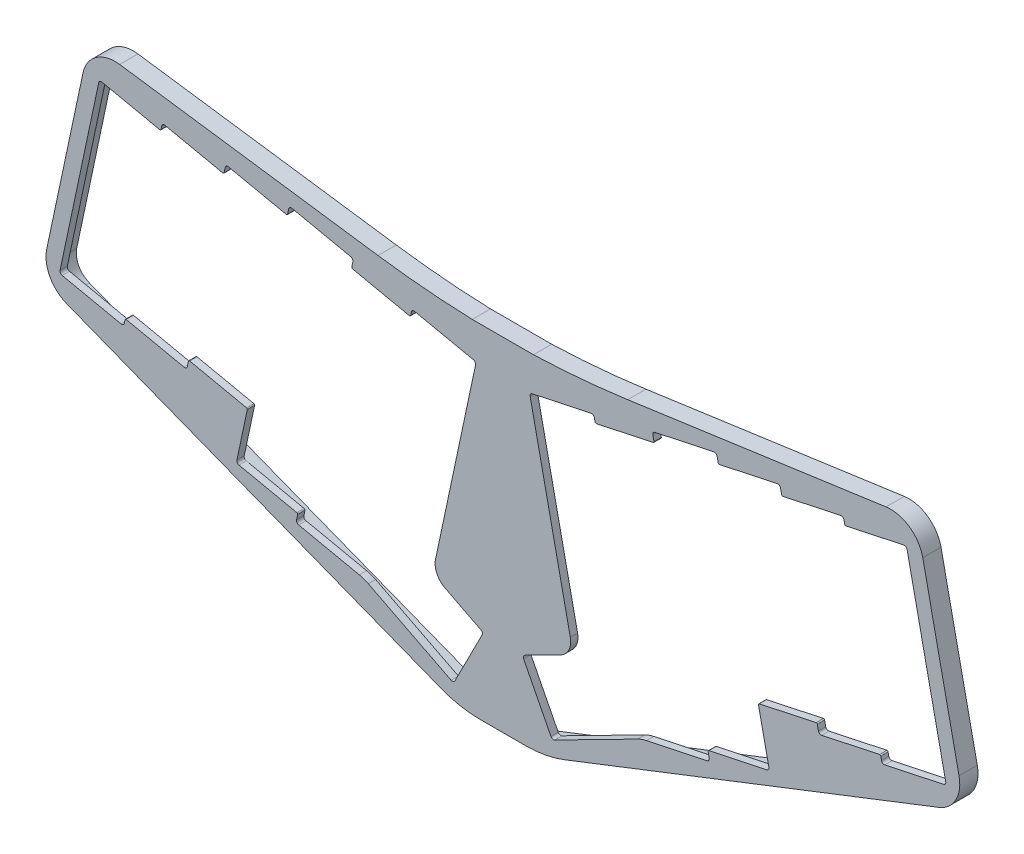
from build123d import *

# Parameters (mm, degrees)
BOSS_EXTRUDE1_DEPTH = 2
BOSS_EXTRUDE2_START = -3
BOSS_EXTRUDE2_DEPTH = 3


with BuildPart() as part:
    # Model → Boss-Extrude1 (new body)
    with BuildSketch(Plane.XY):
        with BuildLine():
            Line((122.868008661, 55.564187288), (106.084164539, 55.564187288))
            ThreePointArc((106.084164539, 55.564187288), (93.132142109, 56.348698919), (80.239503764, 57.815061775))
            Line((80.239503764, 57.815061775), (9.417836232, 67.768398044))
            ThreePointArc((9.417836232, 67.768398044), (3.003090393, 66.228353822), (-0.638050084, 60.727190636))
            Line((-0.638050084, 60.727190636), (-10.587757601, 13.917496875))
            ThreePointArc((-10.587757601, 13.917496875), (-9.704688554, 7.772009077), (-5.052472582, 3.660595964))
            Line((-5.052472582, 3.660595964), (97.645052459, -36.362316839))
            ThreePointArc((97.645052459, -36.362316839), (102.818021289, -37.842589824), (108.175414493, -38.3417418))
            Line((108.175414493, -38.3417418), (120.776758707, -38.3417418))
            ThreePointArc((120.776758707, -38.3417418), (126.134151911, -37.842589824), (131.307120741, -36.362316839))
            Line((131.307120741, -36.362316839), (234.004645782, 3.660595964))
            ThreePointArc((234.004645782, 3.660595964), (238.656861754, 7.772009077), (239.539930801, 13.917496875))
            Line((239.539930801, 13.917496875), (229.590223284, 60.727190636))
            ThreePointArc((229.590223284, 60.727190636), (225.949082807, 66.228353822), (219.534336968, 67.768398044))
            Line((219.534336968, 67.768398044), (148.712669436, 57.815061775))
            ThreePointArc((148.712669436, 57.815061775), (135.820031091, 56.348698919), (122.868008661, 55.564187288))
        make_face()
        with BuildLine():
            ThreePointArc((96.003678434, -6.4654003), (96.381490019, -9.657514237), (98.624463943, -11.959991371))
            Line((98.624463943, -11.959991371), (108.460847672, -16.971879206))
            ThreePointArc((108.460847672, -16.971879206), (108.833647186, -17.408371351), (108.788609694, -17.980626972))
            Line((108.788609694, -17.980626972), (101.297766493, -32.682234674))
            ThreePointArc((101.297766493, -32.682234674), (100.861448486, -33.054977582), (100.289345069, -33.010162873))
            Line((100.289345069, -33.010162873), (77.579498818, -21.438918365))
            ThreePointArc((77.579498818, -21.438918365), (76.377662424, -20.922568705), (75.118710753, -20.567507615))
            Line((75.118710753, -20.567507615), (58.486864133, -17.032299501))
            ThreePointArc((58.486864133, -17.032299501), (58.013794974, -16.707168077), (57.909187199, -16.142755033))
            Line((57.909187199, -16.142755033), (58.210659159, -14.724440967))
            ThreePointArc((58.210659159, -14.724440967), (58.168816049, -14.498675749), (57.979588386, -14.36862318))
            Line((57.979588386, -14.36862318), (42.133597233, -11.000453801))
            ThreePointArc((42.133597233, -11.000453801), (41.660528074, -10.675322377), (41.555920299, -10.110909333))
            Line((41.555920299, -10.110909333), (44.404310457, 3.289712834))
            ThreePointArc((44.404310457, 3.289712834), (44.362467347, 3.515478051), (44.173239684, 3.645530621))
            Line((44.173239684, 3.645530621), (28.620692836, 6.951326487))
            ThreePointArc((28.620692836, 6.951326487), (28.394927608, 6.909483371), (28.264875044, 6.720255691))
            Line((28.264875044, 6.720255691), (27.963403213, 5.30194169))
            ThreePointArc((27.963403213, 5.30194169), (27.638271801, 4.82887249), (27.073858733, 4.724264699))
            Line((27.073858733, 4.724264699), (11.227867583, 8.092434077))
            ThreePointArc((11.227867583, 8.092434077), (11.002102365, 8.050590967), (10.872049796, 7.861363304))
            Line((10.872049796, 7.861363304), (10.674533701, 6.932123133))
            ThreePointArc((10.674533701, 6.932123133), (10.349402277, 6.459053974), (9.784989233, 6.354446199))
            Line((9.784989233, 6.354446199), (-6.354446267, 9.784989099))
            ThreePointArc((-6.354446267, 9.784989099), (-6.827485773, 10.110074866), (-6.932145831, 10.674427064))
            Line((-6.932145831, 10.674427064), (3.671372999, 60.560061267))
            ThreePointArc((3.671372999, 60.560061267), (3.996504423, 61.033130426), (4.560917467, 61.137738201))
            Line((4.560917467, 61.137738201), (20.406908597, 57.769568827))
            ThreePointArc((20.406908597, 57.769568827), (20.632673815, 57.811411937), (20.762726384, 58.0006396))
            Line((20.762726384, 58.0006396), (20.960242499, 58.929879867))
            ThreePointArc((20.960242499, 58.929879867), (21.285373923, 59.402949026), (21.849786967, 59.507556801))
            Line((21.849786967, 59.507556801), (37.695778074, 56.139387432))
            ThreePointArc((37.695778074, 56.139387432), (37.921543292, 56.181230542), (38.051595862, 56.370458205))
            Line((38.051595862, 56.370458205), (38.353067799, 57.788772167))
            ThreePointArc((38.353067799, 57.788772167), (38.678199223, 58.261841326), (39.242612267, 58.366449101))
            Line((39.242612267, 58.366449101), (55.088603505, 54.998279819))
            ThreePointArc((55.088603505, 54.998279819), (55.314368723, 55.040122931), (55.444421291, 55.229350595))
            Line((55.444421291, 55.229350595), (55.745893199, 56.647664467))
            ThreePointArc((55.745893199, 56.647664467), (56.071024623, 57.120733626), (56.635437667, 57.225341401))
            Line((56.635437667, 57.225341401), (72.774873167, 53.794798501))
            ThreePointArc((72.774873167, 53.794798501), (73.247942326, 53.469667077), (73.352550101, 52.905254033))
            Line((73.352550101, 52.905254033), (73.051078046, 51.486939123))
            ThreePointArc((73.051078046, 51.486939123), (73.092921169, 51.261173908), (73.28214884, 51.131121349))
            Line((73.28214884, 51.131121349), (88.834695784, 47.825326391))
            ThreePointArc((88.834695784, 47.825326391), (89.060460999, 47.867169514), (89.190513558, 48.056397185))
            Line((89.190513558, 48.056397185), (89.388029599, 48.985637367))
            ThreePointArc((89.388029599, 48.985637367), (89.713161023, 49.458706526), (90.277574067, 49.563314301))
            Line((90.277574067, 49.563314301), (106.417009567, 46.132771401))
            ThreePointArc((106.417009567, 46.132771401), (106.889970261, 45.807806949), (106.994769191, 45.24361647))
            Line((106.994769191, 45.24361647), (96.003678434, -6.4654003))
        make_face(mode=Mode.SUBTRACT)
        with BuildLine():
            Line((170.465309067, -17.032299501), (153.833462447, -20.567507615))
            ThreePointArc((153.833462447, -20.567507615), (152.574510776, -20.922568705), (151.372674382, -21.438918365))
            Line((151.372674382, -21.438918365), (128.662828131, -33.010162873))
            ThreePointArc((128.662828131, -33.010162873), (128.090724714, -33.054977582), (127.654406707, -32.682234674))
            Line((127.654406707, -32.682234674), (120.163563506, -17.980626972))
            ThreePointArc((120.163563506, -17.980626972), (120.118526014, -17.408371351), (120.491325528, -16.971879206))
            Line((120.491325528, -16.971879206), (130.327709257, -11.959991371))
            ThreePointArc((130.327709257, -11.959991371), (132.570683181, -9.657514237), (132.948494766, -6.4654003))
            Line((132.948494766, -6.4654003), (121.957404009, 45.24361647))
            ThreePointArc((121.957404009, 45.24361647), (122.062202939, 45.807806949), (122.535163633, 46.132771401))
            Line((122.535163633, 46.132771401), (138.674599133, 49.563314301))
            ThreePointArc((138.674599133, 49.563314301), (139.239012177, 49.458706526), (139.564143601, 48.985637367))
            Line((139.564143601, 48.985637367), (139.761659642, 48.056397185))
            ThreePointArc((139.761659642, 48.056397185), (139.891712201, 47.867169514), (140.117477416, 47.825326391))
            Line((140.117477416, 47.825326391), (155.67002436, 51.131121349))
            ThreePointArc((155.67002436, 51.131121349), (155.859252031, 51.261173908), (155.901095154, 51.486939123))
            Line((155.901095154, 51.486939123), (155.599623099, 52.905254033))
            ThreePointArc((155.599623099, 52.905254033), (155.704230874, 53.469667077), (156.177300033, 53.794798501))
            Line((156.177300033, 53.794798501), (172.316735533, 57.225341401))
            ThreePointArc((172.316735533, 57.225341401), (172.881148577, 57.120733626), (173.206280001, 56.647664467))
            Line((173.206280001, 56.647664467), (173.507751909, 55.229350595))
            ThreePointArc((173.507751909, 55.229350595), (173.637804477, 55.040122931), (173.863569695, 54.998279819))
            Line((173.863569695, 54.998279819), (189.709560933, 58.366449101))
            ThreePointArc((189.709560933, 58.366449101), (190.273973977, 58.261841326), (190.599105401, 57.788772167))
            Line((190.599105401, 57.788772167), (190.900577338, 56.370458205))
            ThreePointArc((190.900577338, 56.370458205), (191.030629908, 56.181230542), (191.256395126, 56.139387432))
            Line((191.256395126, 56.139387432), (207.102386233, 59.507556801))
            ThreePointArc((207.102386233, 59.507556801), (207.666799277, 59.402949026), (207.991930701, 58.929879867))
            Line((207.991930701, 58.929879867), (208.189446816, 58.0006396))
            ThreePointArc((208.189446816, 58.0006396), (208.319499385, 57.811411937), (208.545264603, 57.769568827))
            Line((208.545264603, 57.769568827), (224.391255733, 61.137738201))
            ThreePointArc((224.391255733, 61.137738201), (224.955668777, 61.033130426), (225.280800201, 60.560061267))
            Line((225.280800201, 60.560061267), (235.884319031, 10.674427064))
            ThreePointArc((235.884319031, 10.674427064), (235.779658973, 10.110074866), (235.306619467, 9.784989099))
            Line((235.306619467, 9.784989099), (219.167183967, 6.354446199))
            ThreePointArc((219.167183967, 6.354446199), (218.602770923, 6.459053974), (218.277639499, 6.932123133))
            Line((218.277639499, 6.932123133), (218.080123404, 7.861363304))
            ThreePointArc((218.080123404, 7.861363304), (217.950070835, 8.050590967), (217.724305617, 8.092434077))
            Line((217.724305617, 8.092434077), (201.878314467, 4.724264699))
            ThreePointArc((201.878314467, 4.724264699), (201.313901399, 4.82887249), (200.988769987, 5.30194169))
            Line((200.988769987, 5.30194169), (200.687298156, 6.720255691))
            ThreePointArc((200.687298156, 6.720255691), (200.557245592, 6.909483371), (200.331480364, 6.951326487))
            Line((200.331480364, 6.951326487), (184.778933516, 3.645530621))
            ThreePointArc((184.778933516, 3.645530621), (184.589705853, 3.515478051), (184.547862743, 3.289712834))
            Line((184.547862743, 3.289712834), (187.396252901, -10.110909333))
            ThreePointArc((187.396252901, -10.110909333), (187.291645126, -10.675322377), (186.818575967, -11.000453801))
            Line((186.818575967, -11.000453801), (170.972584814, -14.36862318))
            ThreePointArc((170.972584814, -14.36862318), (170.783357151, -14.498675749), (170.741514041, -14.724440967))
            Line((170.741514041, -14.724440967), (171.042986001, -16.142755033))
            ThreePointArc((171.042986001, -16.142755033), (170.938378226, -16.707168077), (170.465309067, -17.032299501))
        make_face(mode=Mode.SUBTRACT)
    extrude(amount=BOSS_EXTRUDE1_DEPTH)

    # Model<6> → Boss-Extrude2 (add)
    with BuildSketch(Plane.XY.offset(BOSS_EXTRUDE2_START)):
        with BuildLine():
            Line((122.868008661, 55.564187288), (106.084164539, 55.564187288))
            ThreePointArc((106.084164539, 55.564187288), (93.132142109, 56.348698919), (80.239503764, 57.815061775))
            Line((80.239503764, 57.815061775), (9.417836232, 67.768398044))
            ThreePointArc((9.417836232, 67.768398044), (3.003090393, 66.228353822), (-0.638050084, 60.727190636))
            Line((-0.638050084, 60.727190636), (-10.587757601, 13.917496875))
            ThreePointArc((-10.587757601, 13.917496875), (-9.704688554, 7.772009077), (-5.052472582, 3.660595964))
            Line((-5.052472582, 3.660595964), (97.645052459, -36.362316839))
            ThreePointArc((97.645052459, -36.362316839), (102.818021289, -37.842589824), (108.175414493, -38.3417418))
            Line((108.175414493, -38.3417418), (120.776758707, -38.3417418))
            ThreePointArc((120.776758707, -38.3417418), (126.134151911, -37.842589824), (131.307120741, -36.362316839))
            Line((131.307120741, -36.362316839), (234.004645782, 3.660595964))
            ThreePointArc((234.004645782, 3.660595964), (238.656861754, 7.772009077), (239.539930801, 13.917496875))
            Line((239.539930801, 13.917496875), (229.590223284, 60.727190636))
            ThreePointArc((229.590223284, 60.727190636), (225.949082807, 66.228353822), (219.534336968, 67.768398044))
            Line((219.534336968, 67.768398044), (148.712669436, 57.815061775))
            ThreePointArc((148.712669436, 57.815061775), (135.820031091, 56.348698919), (122.868008661, 55.564187288))
        make_face()
        with BuildLine():
            Line((122.177023161, -36.0417418), (106.775150039, -36.0417418))
            ThreePointArc((106.775150039, -36.0417418), (105.925356634, -35.962565969), (105.104816751, -35.727764048))
            Line((105.104816751, -35.727764048), (-3.854190006, 6.735351055))
            ThreePointArc((-3.854190006, 6.735351055), (-6.800593455, 9.339246026), (-7.359870518, 13.231388299))
            Line((-7.359870518, 13.231388299), (2.589836999, 60.041082059))
            ThreePointArc((2.589836999, 60.041082059), (4.895892635, 63.525152077), (8.958564999, 64.500513418))
            Line((8.958564999, 64.500513418), (79.780232531, 54.547177148))
            ThreePointArc((79.780232531, 54.547177148), (93.914598791, 52.970377346), (108.115881698, 52.202151472))
            Line((108.115881698, 52.202151472), (108.1260866, 52.202021276))
            Line((108.1260866, 52.202021276), (120.8260866, 52.202021276))
            Line((120.8260866, 52.202021276), (120.836291502, 52.202151472))
            ThreePointArc((120.836291502, 52.202151472), (135.037574409, 52.970377346), (149.171940669, 54.547177148))
            Line((149.171940669, 54.547177148), (219.993608201, 64.500513418))
            ThreePointArc((219.993608201, 64.500513418), (224.056280565, 63.525152077), (226.362336201, 60.041082059))
            Line((226.362336201, 60.041082059), (236.312043718, 13.231388299))
            ThreePointArc((236.312043718, 13.231388299), (235.752766655, 9.339246026), (232.806363206, 6.735351055))
            Line((232.806363206, 6.735351055), (123.847356449, -35.727764048))
            ThreePointArc((123.847356449, -35.727764048), (123.026816566, -35.962565969), (122.177023161, -36.0417418))
        make_face(mode=Mode.SUBTRACT)
    extrude(amount=BOSS_EXTRUDE2_DEPTH)


solid = part.part
